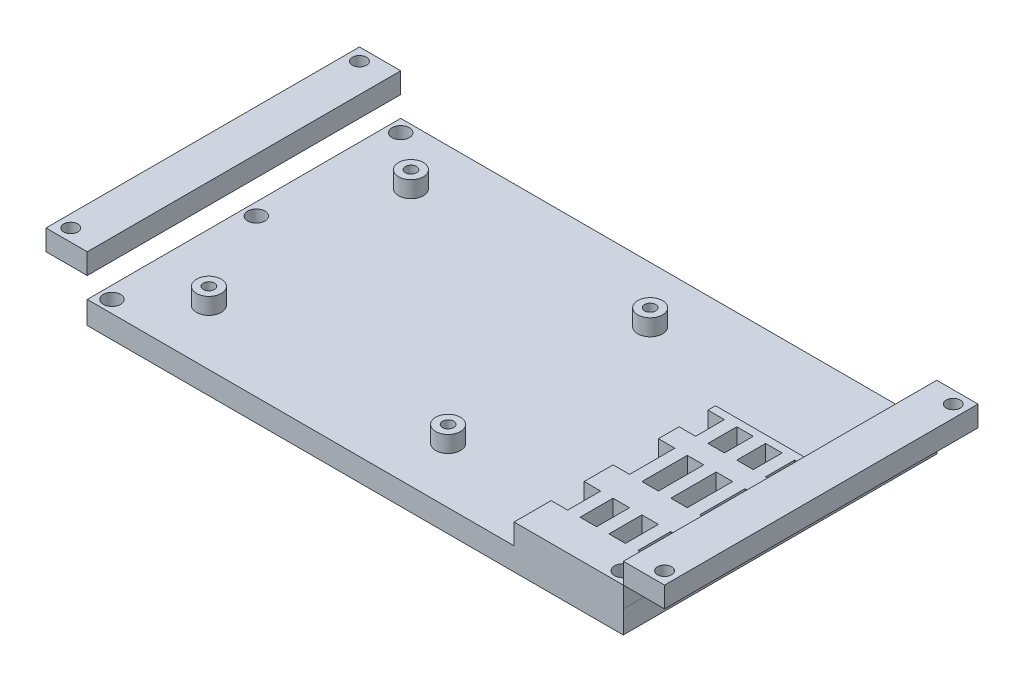
from build123d import *

# Parameters (mm, degrees)
BASES_W                         = 85
BASES_H                         = 56
BASE_DEPTH                      = 0.8
M2_5_CLEARANCE_HOLE_D           = 2.7
FASTENERAREA_START              = -0.01
FASTENERAREAS_R                 = 3
FASTENERAREAS_R_2               = 1.35
FASTENERAREA_DEPTH              = 0.01
FASTENERAREAS_2_R               = 3
FASTENERAREAS_2_R_2             = 1.35
BOSS_EXTRUDE1_DEPTH             = 4
BOSS_EXTRUDE1_2_DEPTH           = 4
HLP_START                       = 0.8
HLP_FASTENERHOLES_OUTLINE_R     = 3
HLP_FASTENERHOLES_OUTLINE_R_2   = 1.35
HLP_FASTENERHOLES_DEPTH         = 4
HLP_FASTENERHOLES_2_OUTLINE_R   = 3
HLP_FASTENERHOLES_2_OUTLINE_R_2 = 1.35
HLP_FASTENERHOLES_2_DEPTH       = 4
HLP_START_2                     = -2
HLP_FASTENERHOLES_3_OUTLINE_R   = 1.35
HLP_FASTENERHOLES_3_DEPTH       = 4
HLP_START_3                     = 0.79
HLP_FASTENERHOLES_4_OUTLINE_R   = 3
HLP_FASTENERHOLES_4_OUTLINE_R_2 = 1.35
HLP_FASTENERHOLES_4_DEPTH       = 1.21
SKETCH4_R                       = 2.1
BOSS_EXTRUDE2_DEPTH             = 5.5
SKETCH7_W                       = 85
SKETCH7_H                       = 56
CUT_EXTRUDE4_DEPTH              = 3
CUT_EXTRUDE5_DEPTH              = 85.244641278
CUT_EXTRUDE5_DEPTH_BACK         = 85.244641278
SKETCH8_R                       = 1.35
SKETCH9_W                       = 26.5
SKETCH9_H                       = 48.839975475
BOSS_EXTRUDE3_DEPTH             = 5
SKETCH12_R                      = 2.1
SKETCH12_W                      = 4
SKETCH12_H                      = 11
SKETCH12_H_2                    = 8
SKETCH12_H_3                    = 7
CUT_EXTRUDE6_DEPTH              = 85.737106223
BOSS_EXTRUDE4_DEPTH             = 3
BOSS_EXTRUDE5_DEPTH             = 5
CUT_EXTRUDE7_DEPTH              = 99.828270638
CUT_EXTRUDE7_DEPTH_BACK         = 99.828270638
SKETCH17_W                      = 1.7
SKETCH17_H                      = 15.5
M3_CLEARANCE_HOLE1_AT_2_COUNT   = 2
M3_CLEARANCE_HOLE1_AT_2_PITCH   = 143.978546352
M3_CLEARANCE_HOLE1_AT_3_COUNT   = 2
M3_CLEARANCE_HOLE1_AT_3_PITCH   = 160.099650194
M3_CLEARANCE_HOLE1_AT_4_COUNT   = 2
M3_CLEARANCE_HOLE1_AT_4_PITCH   = 70.014828304


with BuildPart() as part:
    # BaseS → Base (new, symmetric)
    with BuildSketch(Plane(origin=(0, 0, 0), x_dir=(1, 0, 0), z_dir=(0, 1, 0))):
        Rectangle(BASES_W, BASES_H)
    extrude(amount=BASE_DEPTH, both=True)

    # M2.5 Clearance Hole (through all)
    with Locations(Plane(origin=(0, 0.8, 0), x_dir=(1, 0, 0), z_dir=(0, 1, 0))):
        with Locations((-39, 24.5), (-39, -24.5)):
            Hole(M2_5_CLEARANCE_HOLE_D / 2)

    # FastenerAreaS → FastenerArea (cut)
    # profile 1 of 2: a face of its own
    with BuildSketch(Plane(origin=(0, 0.8, 0), x_dir=(1, 0, 0), z_dir=(0, 1, 0)).offset(FASTENERAREA_START)):
        with Locations(Location((-39, -24.5, 0), (0, 0, 270))):
            Circle(FASTENERAREAS_R)
        with Locations(Location((-39, -24.5, 0), (0, 0, 270))):
            Circle(FASTENERAREAS_R_2, mode=Mode.SUBTRACT)
    # profile 2 of 2: a face of its own
    with BuildSketch(Plane(origin=(0, 0.8, 0), x_dir=(1, 0, 0), z_dir=(0, 1, 0)).offset(FASTENERAREA_START)):
        with Locations(Location((-39, 24.5, 0), (0, 0, 270))):
            Circle(FASTENERAREAS_R)
        with Locations(Location((-39, 24.5, 0), (0, 0, 270))):
            Circle(FASTENERAREAS_R_2, mode=Mode.SUBTRACT)
    fastenerarea = extrude(amount=FASTENERAREA_DEPTH, mode=Mode.SUBTRACT)

    # HLP FastenerHoles 3 outline → HLP FastenerHoles 3 (cut)
    with BuildSketch(Plane(origin=(0, 0, 0), x_dir=(1, 0, 0), z_dir=(0, 1, 0)).offset(HLP_START_2)):
        with Locations((19, -24.5)):
            Circle(HLP_FASTENERHOLES_3_OUTLINE_R)
        with Locations((19, 24.5)):
            Circle(HLP_FASTENERHOLES_3_OUTLINE_R)
    hlp_fastenerholes_3 = extrude(amount=HLP_FASTENERHOLES_3_DEPTH, mode=Mode.SUBTRACT)

    # HLP FastenerHoles 4 outline → HLP FastenerHoles 4 (cut)
    # profile 1 of 2: a face of its own
    with BuildSketch(Plane(origin=(0, 0, 0), x_dir=(1, 0, 0), z_dir=(0, 1, 0)).offset(HLP_START_3)):
        with Locations((19, 24.5)):
            Circle(HLP_FASTENERHOLES_4_OUTLINE_R)
        with Locations((19, 24.5)):
            Circle(HLP_FASTENERHOLES_4_OUTLINE_R_2, mode=Mode.SUBTRACT)
    # profile 2 of 2: a face of its own
    with BuildSketch(Plane(origin=(0, 0, 0), x_dir=(1, 0, 0), z_dir=(0, 1, 0)).offset(HLP_START_3)):
        with Locations((19, -24.5)):
            Circle(HLP_FASTENERHOLES_4_OUTLINE_R)
        with Locations((19, -24.5)):
            Circle(HLP_FASTENERHOLES_4_OUTLINE_R_2, mode=Mode.SUBTRACT)
    hlp_fastenerholes_4 = extrude(amount=HLP_FASTENERHOLES_4_DEPTH, mode=Mode.SUBTRACT)


with BuildPart() as body_2:
    # FastenerAreaS<2> → Boss-Extrude1 (new body)
    with BuildSketch(Plane(origin=(0, 0.8, 0), x_dir=(1, 0, 0), z_dir=(0, 1, 0))):
        with Locations(Location((-39, -24.5, 0), (0, 0, 270))):
            Circle(FASTENERAREAS_2_R)
        with Locations(Location((-39, -24.5, 0), (0, 0, 270))):
            Circle(FASTENERAREAS_2_R_2, mode=Mode.SUBTRACT)
    extrude(amount=BOSS_EXTRUDE1_DEPTH)


with BuildPart() as body_3:
    # FastenerAreaS<2> → Boss-Extrude1 2 (new body)
    with BuildSketch(Plane(origin=(0, 0.8, 0), x_dir=(1, 0, 0), z_dir=(0, 1, 0))):
        with Locations(Location((-39, 24.5, 0), (0, 0, 270))):
            Circle(FASTENERAREAS_2_R)
        with Locations(Location((-39, 24.5, 0), (0, 0, 270))):
            Circle(FASTENERAREAS_2_R_2, mode=Mode.SUBTRACT)
    extrude(amount=BOSS_EXTRUDE1_2_DEPTH)


with BuildPart() as body_4:
    # HLP FastenerHoles: read off the stored shape, not the designer's step
    # HLP FastenerHoles outline → HLP FastenerHoles (new body)
    with BuildSketch(Plane(origin=(0, 0, 0), x_dir=(1, 0, 0), z_dir=(0, 1, 0)).offset(HLP_START)):
        with Locations((19, 24.5)):
            Circle(HLP_FASTENERHOLES_OUTLINE_R)
        with Locations((19, 24.5)):
            Circle(HLP_FASTENERHOLES_OUTLINE_R_2, mode=Mode.SUBTRACT)
    hlp_fastenerholes = extrude(amount=HLP_FASTENERHOLES_DEPTH)


with BuildPart() as body_5:
    # HLP FastenerHoles 2 outline → HLP FastenerHoles 2 (new body)
    with BuildSketch(Plane(origin=(0, 0, 0), x_dir=(1, 0, 0), z_dir=(0, 1, 0)).offset(HLP_START)):
        with Locations((19, -24.5)):
            Circle(HLP_FASTENERHOLES_2_OUTLINE_R)
        with Locations((19, -24.5)):
            Circle(HLP_FASTENERHOLES_2_OUTLINE_R_2, mode=Mode.SUBTRACT)
    hlp_fastenerholes_2 = extrude(amount=HLP_FASTENERHOLES_2_DEPTH)


with BuildPart() as part_1:
    add(part.part)

    # VM FA: FastenerArea, HLP FastenerHoles, HLP FastenerHoles 2, HLP FastenerHoles 3, HLP FastenerHoles 4 across plane
    add(fastenerarea.mirror(Plane.ZX), mode=Mode.SUBTRACT)
    add(hlp_fastenerholes.mirror(Plane.ZX), mode=Mode.SUBTRACT)
    add(hlp_fastenerholes_2.mirror(Plane.ZX), mode=Mode.SUBTRACT)
    add(hlp_fastenerholes_3.mirror(Plane.ZX), mode=Mode.SUBTRACT)
    add(hlp_fastenerholes_4.mirror(Plane.ZX), mode=Mode.SUBTRACT)

    # Sketch4 → Boss-Extrude2 (add)
    with BuildSketch(Plane.XZ.offset(-0.8)):
        Polygon((55.021462019, -38.014828304), (-55, -38.014828304), (-55, 38), (54.978546352, 38), (74.978546352, 38), (74.978546352, -38.014828304), align=None)
        with Locations(Location((-52, 35, 0), (0, 0, 270))):
            Circle(SKETCH4_R, mode=Mode.SUBTRACT)
        with Locations(Location((-52, -35.014828304, 0), (0, 0, 270))):
            Circle(SKETCH4_R, mode=Mode.SUBTRACT)
        with Locations(Location((71.978546352, -35.014828304, 0), (0, 0, 270))):
            Circle(SKETCH4_R, mode=Mode.SUBTRACT)
        with Locations(Location((71.978546352, 35, 0), (0, 0, 270))):
            Circle(SKETCH4_R, mode=Mode.SUBTRACT)
        with Locations(Location((-52, 0, 0), (0, 0, 270))):
            Circle(SKETCH4_R, mode=Mode.SUBTRACT)
    extrude(amount=BOSS_EXTRUDE2_DEPTH)

    # Sketch7 → Cut-Extrude4 (cut)
    with BuildSketch(Plane.XZ.offset(4.7)):
        Rectangle(SKETCH7_W, SKETCH7_H)
    extrude(amount=-CUT_EXTRUDE4_DEPTH, mode=Mode.SUBTRACT)

    # Sketch8 → Cut-Extrude5 (cut, two sides: drawn at the far end of the back side and taken through both)
    with BuildSketch(Plane(origin=(0, 0.8, 0), x_dir=(1, 0, 0), z_dir=(0, 1, 0)).offset(-CUT_EXTRUDE5_DEPTH_BACK)):
        with Locations(Location((19, -24.5, 0), (0, 0, 270))):
            Circle(SKETCH8_R)
        with Locations(Location((19, 24.5, 0), (0, 0, 270))):
            Circle(SKETCH8_R)
        with Locations(Location((-39, 24.5, 0), (0, 0, 270))):
            Circle(SKETCH8_R)
        with Locations(Location((-39, -24.5, 0), (0, 0, 270))):
            Circle(SKETCH8_R)
    extrude(amount=CUT_EXTRUDE5_DEPTH + CUT_EXTRUDE5_DEPTH_BACK, mode=Mode.SUBTRACT)

    # Sketch9 → Boss-Extrude3 (add)
    with BuildSketch(Plane(origin=(0, 0.8, 0), x_dir=(1, 0, 0), z_dir=(0, 1, 0))):
        with Locations((61.75, -13.580012262)):
            Rectangle(SKETCH9_W, SKETCH9_H)
    extrude(amount=BOSS_EXTRUDE3_DEPTH)

    # Sketch12 → Cut-Extrude6 (cut, through all)
    with BuildSketch(Plane.XZ.offset(4.7)):
        with Locations(Location((71.978546352, 35, 0), (0, 0, 270))):
            Circle(SKETCH12_R)
        with Locations(Location((71.978546352, -35.014828304, 0), (0, 0, 270))):
            Circle(SKETCH12_R)
        with Locations((57.5, 8.5)):
            Rectangle(SKETCH12_W, SKETCH12_H)
        with Locations((50.5, 8.5)):
            Rectangle(SKETCH12_W, SKETCH12_H)
        with Locations((64.5, 8.5)):
            Rectangle(SKETCH12_W, SKETCH12_H)
        with Locations((71.5, 8.5)):
            Rectangle(SKETCH12_W, SKETCH12_H)
        with Locations((50.5, 25)):
            Rectangle(SKETCH12_W, SKETCH12_H_2)
        with Locations((57.5, 25)):
            Rectangle(SKETCH12_W, SKETCH12_H_2)
        with Locations((64.5, 25)):
            Rectangle(SKETCH12_W, SKETCH12_H_2)
        with Locations((71.5, 25)):
            Rectangle(SKETCH12_W, SKETCH12_H_2)
        with Locations((50.5, -5.5)):
            Rectangle(SKETCH12_W, SKETCH12_H_3)
        with Locations((57.5, -5.5)):
            Rectangle(SKETCH12_W, SKETCH12_H_3)
        with Locations((64.5, -5.5)):
            Rectangle(SKETCH12_W, SKETCH12_H_3)
        with Locations((71.5, -5.5)):
            Rectangle(SKETCH12_W, SKETCH12_H_3)
    extrude(amount=-CUT_EXTRUDE6_DEPTH, mode=Mode.SUBTRACT)

    # Sketch13 → Boss-Extrude4 (add)
    with BuildSketch(Plane.XZ.offset(1.7)):
        Polygon((-42.5, -15), (-42.5, 15), (-17.5, 15), (-17.5, 28), (15.5, 28), (15.5, 15), (42.5, 15), (42.5, -15), (15.5, -15), (15.5, -28), (-17.5, -28), (-17.5, -15), align=None)
    extrude(amount=BOSS_EXTRUDE4_DEPTH)


with BuildPart() as body_6:
    # Sketch15 → Boss-Extrude5 (new body)
    with BuildSketch(Plane(origin=(0, 5.8, 0), x_dir=(1, 0, 0), z_dir=(0, 1, 0))):
        Polygon((74.978546352, 38.014828304), (74.978546352, 10.839975475), (75, 10.839975475), (75, 0.839975475), (84.978546352, 0.839975475), (84.978546352, 48.014828304), (-65, 48.014828304), (-65, -48), (58.5, -48), (58.5, -38), (48.5, -38), (-55, -38), (-55, 38.014828304), align=None)
        Polygon((84.978546352, 0.839975475), (75, 0.839975475), (75, -38), (58.5, -38), (58.5, -48), (84.978546352, -48), align=None)
    extrude(amount=BOSS_EXTRUDE5_DEPTH)

    # Sketch19 → Cut-Extrude7 (cut, two sides: drawn at the far end of the back side and taken through both)
    with BuildSketch(Plane(origin=(0, 10.8, 0), x_dir=(1, 0, 0), z_dir=(0, 1, 0)).offset(-CUT_EXTRUDE7_DEPTH_BACK)):
        Polygon((84.978546352, 48.014828304), (-65, 48.014828304), (-65, 38.014828304), (-55, 38.014828304), (74.978546352, 38.014828304), (84.978546352, 38.014828304), align=None)
        Polygon((-55, -38), (-65, -38), (-65, -48), (84.978546352, -48), (84.978546352, -38), (75, -38), (48.5, -38), align=None)
    extrude(amount=CUT_EXTRUDE7_DEPTH + CUT_EXTRUDE7_DEPTH_BACK, mode=Mode.SUBTRACT)


with BuildPart() as cut_extrude7_piece_1:
    # of the separate pieces the step leaves, piece 1, a body of its own (cut_extrude7_pieces)
    add(body_6.part.solids().sort_by_distance((-55, 5.8, 38))[0])

    # Sketch17 → M3 Clearance Hole1 (revolve, cut)
    with BuildSketch(Plane(origin=(-62, 10.8, -35.014828304), x_dir=(0, 0, 1), z_dir=(1, 0, 0))):
        with Locations((0.85, 7.75)):
            Rectangle(SKETCH17_W, SKETCH17_H)
    m3_clearance_hole1 = revolve(axis=Axis((-62, 17.15, -35.014828304), (0, -1, 0)), mode=Mode.SUBTRACT)

    # M3 Clearance Hole1 at 4: M3 Clearance Hole1 ×2
    with Locations(*[(0, 0, i * M3_CLEARANCE_HOLE1_AT_4_PITCH) for i in range(1, M3_CLEARANCE_HOLE1_AT_4_COUNT)]):
        add(m3_clearance_hole1, mode=Mode.SUBTRACT)


with BuildPart() as cut_extrude7_piece_2:
    # of the separate pieces the step leaves, piece 2, a body of its own (cut_extrude7_pieces)
    add(body_6.part.solids().sort_by_distance((74.978546352, 5.8, -38.014828304))[0])

    # M3 Clearance Hole1 at 2: M3 Clearance Hole1 ×2
    with Locations(*[(i * M3_CLEARANCE_HOLE1_AT_2_PITCH, 0, 0) for i in range(1, M3_CLEARANCE_HOLE1_AT_2_COUNT)]):
        add(m3_clearance_hole1, mode=Mode.SUBTRACT)

    # M3 Clearance Hole1 at 3: M3 Clearance Hole1 ×2
    with Locations(*[Vector(0.8993058147090349, 0, 0.4373203078185589) * (i * M3_CLEARANCE_HOLE1_AT_3_PITCH) for i in range(1, M3_CLEARANCE_HOLE1_AT_3_COUNT)]):
        add(m3_clearance_hole1, mode=Mode.SUBTRACT)


solid = Compound([body_2.part, body_3.part, body_4.part, body_5.part, part_1.part, cut_extrude7_piece_1.part, cut_extrude7_piece_2.part])
